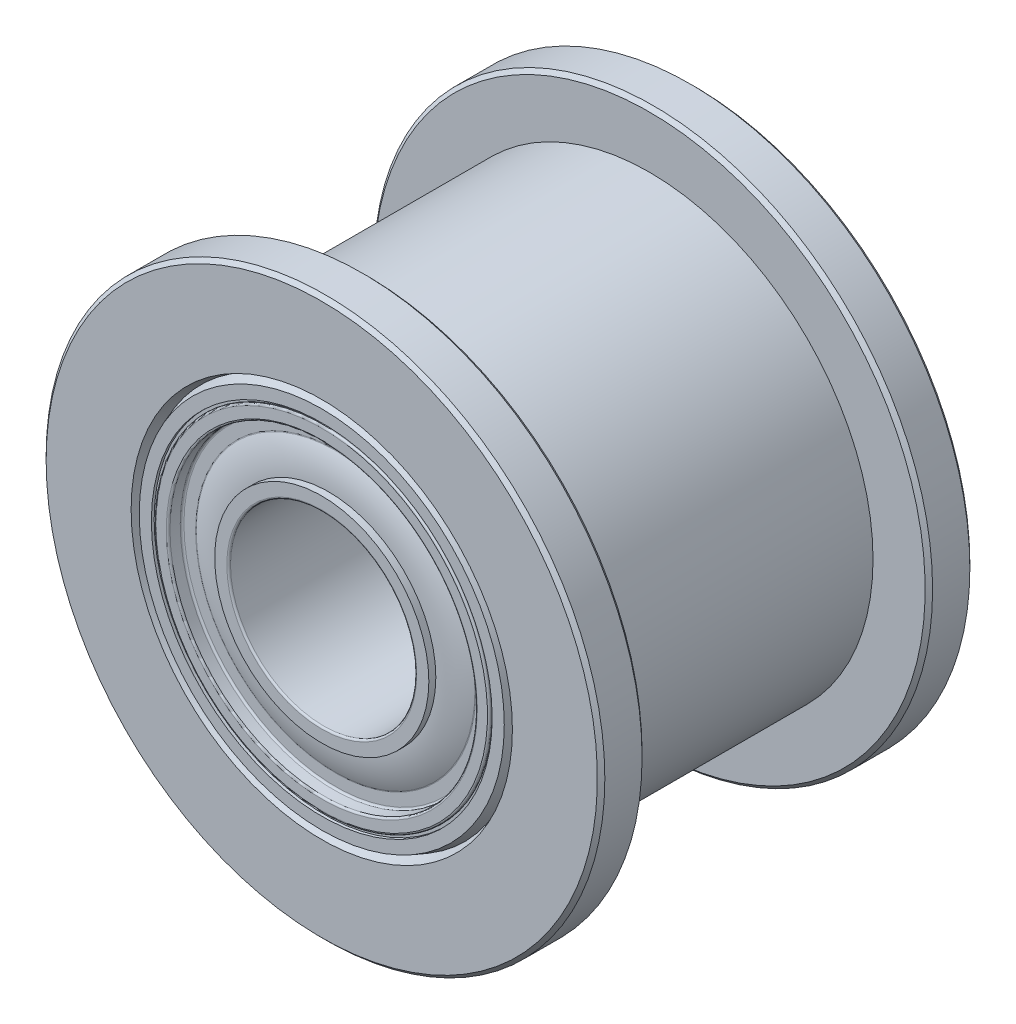
from build123d import *

# Parameters (mm, degrees)
CHAMFER1_SIZE = 0.1
FILLET2_R     = 0.05


with BuildPart() as part:
    # Sketch2 → Revolve1 (revolve)
    with BuildSketch(Plane(origin=(0, 0, 0), x_dir=(0, 0, -1), z_dir=(1, 0, 0))):
        with BuildLine():
            Line((5, 2.5), (0, 2.5))
            Line((0, 2.5), (0, 4.5))
            Line((0, 4.5), (5, 4.5))
            Line((5, 4.5), (5, 4.125))
            Line((5, 4.125), (4.625, 4.125))
            Line((4.625, 4.125), (4.625, 3.75))
            ThreePointArc((4.625, 3.75), (4.765098905, 3.322431908), (4.8125, 2.875))
            Line((4.8125, 2.875), (5, 2.875))
            Line((5, 2.875), (5, 2.5))
        make_face()
    revolve(axis=Axis((0, 0, 5), (0, 0, -1)))

    # Mirror1: part across plane


with BuildPart() as part_1:
    add(part.part)
    add(part.part.mirror(Plane.XY))

    # Fillet2
    fillet2_edges = [part_1.edges().sort_by_distance(p)[0] for p in [
        (0, -3.75, 4.625),
        (0, -4.125, 4.625),
        (0, -4.5, 5),
        (0, -4.125, 5),
        (0, -2.5, 5),
        (0, -2.5, -5),
        (0, -4.5, -5),
        (0, -3.75, -4.625),
        (0, -4.125, -5),
        (0, -2.875, -5),
    ]]
    fillet(fillet2_edges, radius=FILLET2_R)


with BuildPart() as body_2:
    # Sketch3 → Revolve2 (revolve)
    with BuildSketch(Plane(origin=(0, 0, 0), x_dir=(0, 0, -1), z_dir=(1, 0, 0))):
        Polygon((3.8, 7.5), (5, 7.5), (5, 5.118382141), (4.7, 5.00919107), (5, 4.9), (5, 4.575), (4.925, 4.575), (4.925, 4.5), (-4.925, 4.5), (-4.925, 4.575), (-5, 4.575), (-5, 4.9), (-4.7, 5.00919107), (-5, 5.118382141), (-5, 7.5), (-3.8, 7.5), (-3.8, 6), (3.8, 6), align=None)
    revolve(axis=Axis((0, 0, 5), (0, 0, -1)))

    # Chamfer1
    chamfer1_edges = [body_2.edges().sort_by_distance(p)[0] for p in [
        (0, -7.5, -5),
        (0, -7.5, -3.8),
        (0, -7.5, 3.8),
        (0, -7.5, 5),
    ]]
    chamfer(chamfer1_edges, length=CHAMFER1_SIZE)

    # Combine1: union part
    add(part_1.part)


solid = body_2.part
